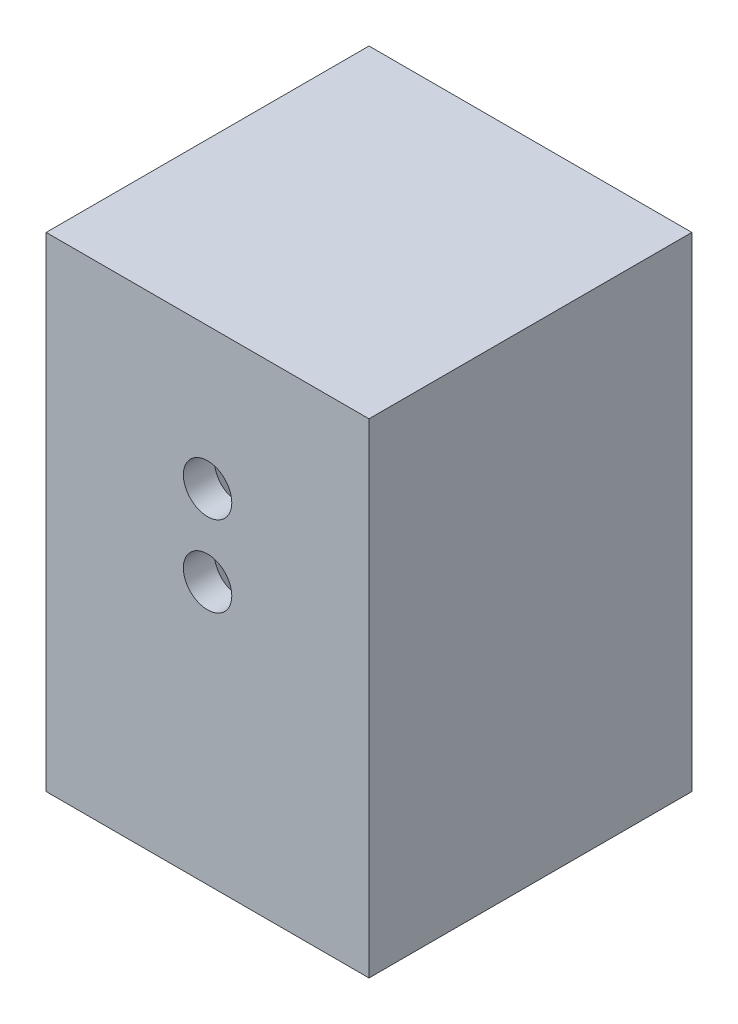
from build123d import *

# Parameters (mm, degrees)
SKETCH5_W           = 101.6
SKETCH5_H           = 101.6
BOSS_EXTRUDE1_DEPTH = 152.4
SKETCH6_R           = 41.91
CUT_EXTRUDE1_DEPTH  = 127
SKETCH5_3_W         = 20.32
SKETCH5_3_H         = 20.32
CUT_EXTRUDE2_DEPTH  = 25.4
SKETCH9_R           = 7.62
CUT_EXTRUDE4_DEPTH  = 56.642


with BuildPart() as part:
    # Sketch5 → Boss-Extrude1 (new body)
    with BuildSketch(Plane(origin=(0, 0, 0), x_dir=(1, 0, 0), z_dir=(0, 1, 0))):
        with Locations((50.8, 50.8)):
            Rectangle(SKETCH5_W, SKETCH5_H)
    extrude(amount=BOSS_EXTRUDE1_DEPTH)

    # Sketch6 → Cut-Extrude1 (cut)
    with BuildSketch(Plane(origin=(0, 0, 0), x_dir=(1, 0, 0), z_dir=(0, 1, 0))):
        with Locations((50.8, 50.8)):
            Circle(SKETCH6_R)
    extrude(amount=CUT_EXTRUDE1_DEPTH, mode=Mode.SUBTRACT)

    # Sketch5<3> → Cut-Extrude2 (cut)
    with BuildSketch(Plane(origin=(0, 0, 0), x_dir=(1, 0, 0), z_dir=(0, 1, 0))):
        with Locations((85.09, 15.457317153)):
            Rectangle(SKETCH5_3_W, SKETCH5_3_H)
        with Locations((16.51, 15.457317153)):
            Rectangle(SKETCH5_3_W, SKETCH5_3_H)
        with Locations((85.09, 85.09)):
            Rectangle(SKETCH5_3_W, SKETCH5_3_H)
        with Locations((16.51, 85.09)):
            Rectangle(SKETCH5_3_W, SKETCH5_3_H)
    extrude(amount=CUT_EXTRUDE2_DEPTH, mode=Mode.SUBTRACT)

    # Sketch9 → Cut-Extrude4 (cut)
    with BuildSketch(Plane.XY):
        with Locations((50.8, 107.95)):
            Circle(SKETCH9_R)
        with Locations((50.8, 82.55)):
            Circle(SKETCH9_R)
    extrude(amount=-CUT_EXTRUDE4_DEPTH, mode=Mode.SUBTRACT)


solid = part.part
